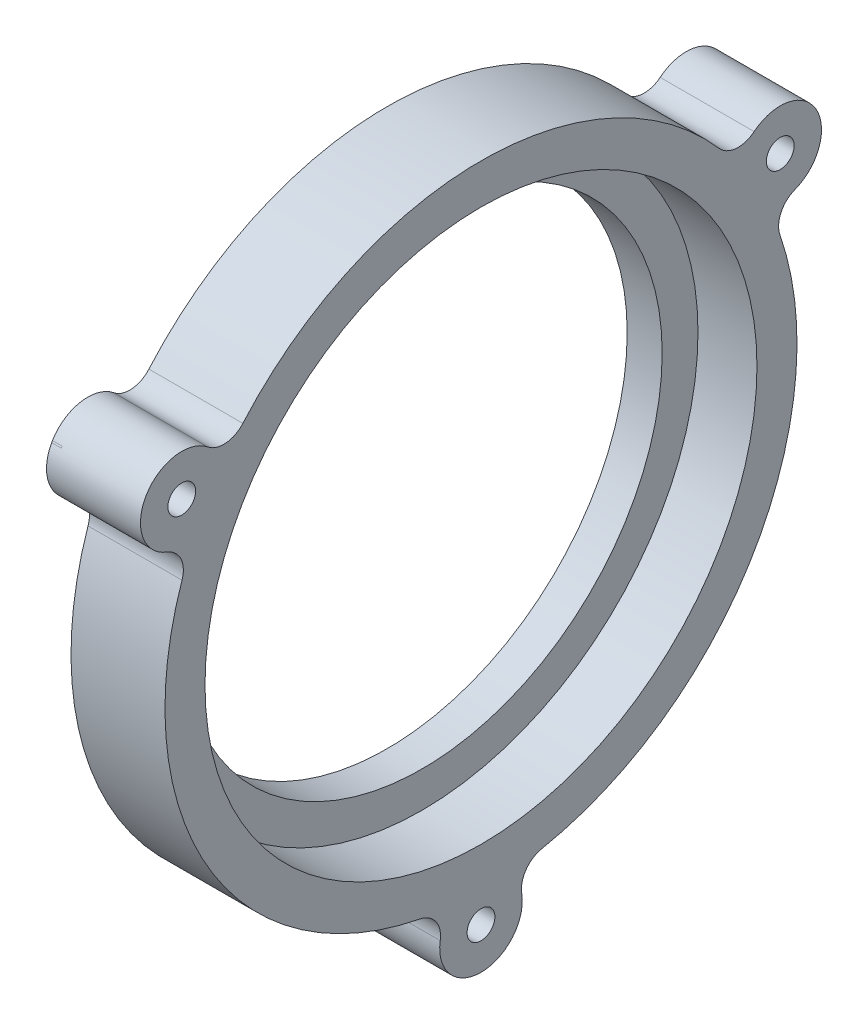
from build123d import *
from build123d.topology import SkipClean

# Parameters (mm, degrees)
BASPROSKE_W         = 26
BASPROSKE_H         = 4.375
TOOTHCUT_DEPTH      = 60.063525123
TEETHCUTS_COUNT     = 55
TEETHCUTS_ANGLE     = 353.454545455
SKETCH2_R           = 37.5
BOSS_EXTRUDE2_DEPTH = 4.5
SKETCH3_R           = 2.25
SKETCH3_R_2         = 1.8
CUT_EXTRUDE1_DEPTH  = 4.5
SKETCH4_R           = 3.25
CUT_EXTRUDE2_DEPTH  = 3
BOSS_EXTRUDE3_START = 4
SKETCH5_R           = 37.5
SKETCH5_R_2         = 28.5
BOSS_EXTRUDE3_DEPTH = 4
BOSS_EXTRUDE4_START = 7
SKETCH6_R           = 37.5
SKETCH6_R_2         = 32.75
BOSS_EXTRUDE4_DEPTH = 7
SKETCH7_R           = 1.65
BOSS_EXTRUDE5_DEPTH = 10
FILLET1_R           = 3
BOSS_EXTRUDE6_START = -10
SKETCH8_R           = 1.65
BOSS_EXTRUDE6_DEPTH = 10
FILLET2_R           = 3
SKETCH9_R           = 37.6
SKETCH9_R_2         = 37.5
BOSS_EXTRUDE7_DEPTH = 10
FILLET3_R           = 3
SKETCH10_R          = 45.899134002
SKETCH10_R_2        = 2.25
CUT_EXTRUDE3_DEPTH  = 31.5
SKETCH12_R          = 1.65
SKETCH12_R_2        = 28.5
BOSS_EXTRUDE8_DEPTH = 1.15


with BuildPart() as part:
    # BasProSke → Base-Revolve (revolve)
    with BuildSketch(Plane(origin=(0, 0, 0), x_dir=(1, 0, 0), z_dir=(0, 1, 0)), mode=Mode.PRIVATE) as base_revolve_sk:
        with Locations((13, 35.3125)):
            Rectangle(BASPROSKE_W, BASPROSKE_H)
    revolve(base_revolve_sk.sketch.rotate(Axis((-10, 0, 0), (1, 0, 0)), 180), axis=Axis((-10, 0, 0), (1, 0, 0)))

    # TooCutSke → ToothCut (cut, through all)
    with BuildSketch(Plane(origin=(0, 0, 0), x_dir=(0, 0, -1), z_dir=(1, 0, 0))):
        with BuildLine():
            ThreePointArc((1.451447951, 33.067761022), (1.040603726, 34.522224287), (0.503573985, 35.934971761))
            ThreePointArc((0.503573985, 35.934971761), (0, 35.9385), (-0.503573985, 35.934971761))
            ThreePointArc((-0.503573985, 35.934971761), (-1.040603726, 34.522224287), (-1.451447951, 33.067761022))
            ThreePointArc((-1.451447951, 33.067761022), (0, 33.0996), (1.451447951, 33.067761022))
        make_face()
    toothcut = extrude(amount=TOOTHCUT_DEPTH, mode=Mode.SUBTRACT)

    # TeethCuts: ToothCut ×55 about axis
    teethcuts_axis = Axis((-10, 0, 0), (1, 0, 0))
    for i in range(1, TEETHCUTS_COUNT):
        add(toothcut.rotate(teethcuts_axis, i * TEETHCUTS_ANGLE / (TEETHCUTS_COUNT - 1)), mode=Mode.SUBTRACT)

    # Sketch2 → Boss-Extrude2 (add)
    with BuildSketch(Plane.ZY):
        Circle(SKETCH2_R)
    extrude(amount=BOSS_EXTRUDE2_DEPTH)

    # Sketch3 → Cut-Extrude1 (cut)
    with BuildSketch(Plane.ZY.offset(4.5)):
        Circle(SKETCH3_R)
        with Locations((0, 8.5)):
            Circle(SKETCH3_R_2)
        with Locations(Location((0, -8.5, 0), (0, 0, 180))):
            Circle(SKETCH3_R_2)
    extrude(amount=-CUT_EXTRUDE1_DEPTH, mode=Mode.SUBTRACT)

    # Sketch4 → Cut-Extrude2 (cut)
    with BuildSketch(Plane(origin=(0, 0, 0), x_dir=(0, 0, -1), z_dir=(1, 0, 0))):
        with Locations((0, -8.5)):
            Circle(SKETCH4_R)
        with Locations((0, 8.5)):
            Circle(SKETCH4_R)
    extrude(amount=-CUT_EXTRUDE2_DEPTH, mode=Mode.SUBTRACT)

    # Sketch5 → Boss-Extrude3 (add)
    with BuildSketch(Plane(origin=(26, 0, 0), x_dir=(0, 0, -1), z_dir=(1, 0, 0)).offset(BOSS_EXTRUDE3_START)):
        with Locations(Location((0, 0, 0), (0, 0, 180))):
            Circle(SKETCH5_R)
        Circle(SKETCH5_R_2, mode=Mode.SUBTRACT)
    extrude(amount=-BOSS_EXTRUDE3_DEPTH)

    # Sketch6 → Boss-Extrude4 (add)
    with BuildSketch(Plane(origin=(30, 0, 0), x_dir=(0, 0, -1), z_dir=(1, 0, 0)).offset(BOSS_EXTRUDE4_START)):
        with Locations(Location((0, 0, 0), (0, 0, 180))):
            Circle(SKETCH6_R)
        Circle(SKETCH6_R_2, mode=Mode.SUBTRACT)
    extrude(amount=-BOSS_EXTRUDE4_DEPTH)

    # Sketch7 → Boss-Extrude5 (add)
    # profile 1 of 3: a face of its own
    with BuildSketch(Plane(origin=(37, 0, 0), x_dir=(0, 0, -1), z_dir=(1, 0, 0))):
        with BuildLine():
            ThreePointArc((-30.713496008, 21.515835168), (-39.750566034, 22.95), (-33.990007843, 15.840750198))
            ThreePointArc((-33.990007843, 15.840750198), (-32.475952642, 18.75), (-30.713496008, 21.515835168))
        make_face()
        with Locations((-35.507041555, 20.5)):
            Circle(SKETCH7_R, mode=Mode.SUBTRACT)
    # profile 2 of 3: a face of its own
    with BuildSketch(Plane(origin=(37, 0, 0), x_dir=(0, 0, -1), z_dir=(1, 0, 0))):
        with BuildLine():
            ThreePointArc((-3.276511835, -37.356585366), (0, -45.9), (3.276511835, -37.356585366))
            ThreePointArc((3.276511835, -37.356585366), (0, -37.5), (-3.276511835, -37.356585366))
        make_face()
        with Locations((0, -41)):
            Circle(SKETCH7_R, mode=Mode.SUBTRACT)
    # profile 3 of 3: a face of its own
    with BuildSketch(Plane(origin=(37, 0, 0), x_dir=(0, 0, -1), z_dir=(1, 0, 0))):
        with BuildLine():
            ThreePointArc((30.713496008, 21.515835168), (32.475952642, 18.75), (33.990007843, 15.840750198))
            ThreePointArc((33.990007843, 15.840750198), (39.750566034, 22.95), (30.713496008, 21.515835168))
        make_face()
        with Locations((35.507041555, 20.5)):
            Circle(SKETCH7_R, mode=Mode.SUBTRACT)
    extrude(amount=-BOSS_EXTRUDE5_DEPTH)

    # Fillet1
    fillet1_edges = [part.edges().sort_by_distance(p)[0] for p in [
        (32, 15.840750198, 33.990007843),
        (32, 21.515835168, 30.713496008),
        (32, -37.356585366, -3.276511835),
        (32, -37.356585366, 3.276511835),
        (32, 21.515835168, -30.713496008),
        (32, 15.840750198, -33.990007843),
    ]]
    fillet(fillet1_edges, radius=FILLET1_R)

    # Sketch8 → Boss-Extrude6 (add)
    # profile 1 of 3: a face of its own
    with BuildSketch(Plane.ZY.offset(4.5).offset(BOSS_EXTRUDE6_START)):
        with BuildLine():
            ThreePointArc((3.277032239, 37.357537298), (-0.001858552, 45.899133961), (-3.279499265, 37.357057531))
            ThreePointArc((-3.279499265, 37.357057531), (-0.001244018, 37.500865925), (3.277032239, 37.357537298))
        make_face()
        with Locations((0, 41)):
            Circle(SKETCH8_R, mode=Mode.SUBTRACT)
    # profile 2 of 3: a face of its own
    with BuildSketch(Plane.ZY.offset(4.5).offset(BOSS_EXTRUDE6_START)):
        with BuildLine():
            ThreePointArc((30.71426819, -21.517740103), (39.750655671, -22.948112687), (33.993202634, -15.837979147))
            ThreePointArc((33.993202634, -15.837979147), (32.478138639, -18.749677793), (30.71426819, -21.517740103))
        make_face()
        with Locations((35.507041555, -20.5)):
            Circle(SKETCH8_R, mode=Mode.SUBTRACT)
    # profile 3 of 3: a face of its own
    with BuildSketch(Plane.ZY.offset(4.5).offset(BOSS_EXTRUDE6_START)):
        with BuildLine():
            ThreePointArc((-30.712203543, -21.517680022), (-32.47526663, -18.751188157), (-33.989800256, -15.841195617))
            ThreePointArc((-33.989800256, -15.841195617), (-39.748976395, -22.951021278), (-30.712203543, -21.517680022))
        make_face()
        with Locations((-35.507041555, -20.5)):
            Circle(SKETCH8_R, mode=Mode.SUBTRACT)
    extrude(amount=BOSS_EXTRUDE6_DEPTH)


with BuildPart() as boss_extrude6_piece_1:
    # of the separate pieces the step leaves, piece 1, a body of its own (boss_extrude6_pieces)
    add(part.part.solids().sort_by_distance((37, -36.798102981, 7.221469172))[0])

    # Fillet2
    fillet2_edges = [boss_extrude6_piece_1.edges().sort_by_distance(p)[0] for p in [
        (0.5, -21.517680022, -30.712203543),
        (0.5, -15.841195617, -33.989800256),
    ]]
    fillet(fillet2_edges, radius=FILLET2_R)



with BuildPart() as boss_extrude6_piece_2:
    # of the separate pieces the step leaves, piece 2, a body of its own (boss_extrude6_pieces)
    add(part.part.solids().sort_by_distance((5.5, 37.357057531, -3.279499265))[0])


with BuildPart() as boss_extrude6_piece_3:
    # of the separate pieces the step leaves, piece 3, a body of its own (boss_extrude6_pieces)
    add(part.part.solids().sort_by_distance((5.5, -15.837979147, 33.993202634))[0])


with BuildPart() as boss_extrude6_piece_1_1:
    add(boss_extrude6_piece_1.part)

    add(boss_extrude6_piece_2.part)  # Boss-Extrude7 merges Boss-Extrude6 piece 2

    add(boss_extrude6_piece_3.part)  # Boss-Extrude7 merges Boss-Extrude6 piece 3
    # Sketch9 → Boss-Extrude7 (add)
    with BuildSketch(Plane.ZY.offset(4.5)):
        Circle(SKETCH9_R)
        Circle(SKETCH9_R_2, mode=Mode.SUBTRACT)
    extrude(amount=-BOSS_EXTRUDE7_DEPTH)

    # Fillet3
    fillet3_edges = [boss_extrude6_piece_1_1.edges().sort_by_distance(p)[0] for p in [
        (0.5, 37.448219223, 3.375037342),
        (0.5, 37.447972163, -3.377777505),
        (0.5, -21.646977688, 30.743590502),
        (0.5, -15.798744954, 34.119783966),
    ]]
    fillet(fillet3_edges, radius=FILLET3_R)

    # Sketch10 → Cut-Extrude3 (cut)
    with BuildSketch(Plane.ZY.offset(4.5)):
        Circle(SKETCH10_R)
        Circle(SKETCH10_R_2, mode=Mode.SUBTRACT)
    extrude(amount=-CUT_EXTRUDE3_DEPTH, mode=Mode.SUBTRACT)

    # Sketch12 → Boss-Extrude8 (add)
    with SkipClean():  # the faces are left unmerged after this step: merging them gives an invalid solid
        with BuildSketch(Plane.ZY.offset(-27)):
            with BuildLine():
                ThreePointArc((-32.412539248, 24.299217745), (-39.750566034, 22.95), (-37.250009483, 15.920473518))
                ThreePointArc((-37.250009483, 15.920473518), (-35.60116111, 14.39084752), (-35.478826578, 12.145075735))
                ThreePointArc((-35.478826578, 12.145075735), (-32.475952642, -18.75), (-7.221469172, -36.798102981))
                ThreePointArc((-7.221469172, -36.798102981), (-5.33774102, -38.026933686), (-4.837470235, -40.219691263))
                ThreePointArc((-4.837470235, -40.219691263), (0, -45.9), (4.837470235, -40.219691263))
                ThreePointArc((4.837470235, -40.219691263), (5.33774102, -38.026933686), (7.221469172, -36.798102981))
                ThreePointArc((7.221469172, -36.798102981), (32.475952642, -18.75), (35.478826578, 12.145075735))
                ThreePointArc((35.478826578, 12.145075735), (35.60116111, 14.39084752), (37.250009483, 15.920473518))
                ThreePointArc((37.250009483, 15.920473518), (39.750566034, 22.95), (32.412539248, 24.299217745))
                ThreePointArc((32.412539248, 24.299217745), (30.26342009, 23.636086166), (28.257357407, 24.653027246))
                ThreePointArc((28.257357407, 24.653027246), (0, 37.5), (-28.257357407, 24.653027246))
                ThreePointArc((-28.257357407, 24.653027246), (-30.177504217, 23.644648787), (-32.275580689, 24.194072128))
                add(Edge.make_bspline(
                    [(-32.275580681, 24.194072138), (-32.299145006, 24.211107976), (-32.322416857, 24.228349689), (-32.345393979, 24.245789385), (-32.368074444, 24.26341918), (-32.390456638, 24.28123123), (-32.412539248, 24.299217745)],
                    knots=[0.959340684, 0.959340684, 0.959340684, 0.959340684, 0.959340684, 0.959340684, 0.959340684, 1, 1, 1, 1, 1, 1, 1], degree=6))
            make_face()
            with Locations((0, -41)):
                Circle(SKETCH12_R, mode=Mode.SUBTRACT)
            with Locations((-35.507041555, 20.5)):
                Circle(SKETCH12_R, mode=Mode.SUBTRACT)
            Circle(SKETCH12_R_2, mode=Mode.SUBTRACT)
            with Locations((35.507041555, 20.5)):
                Circle(SKETCH12_R, mode=Mode.SUBTRACT)
        extrude(amount=BOSS_EXTRUDE8_DEPTH)


solid = boss_extrude6_piece_1_1.part
